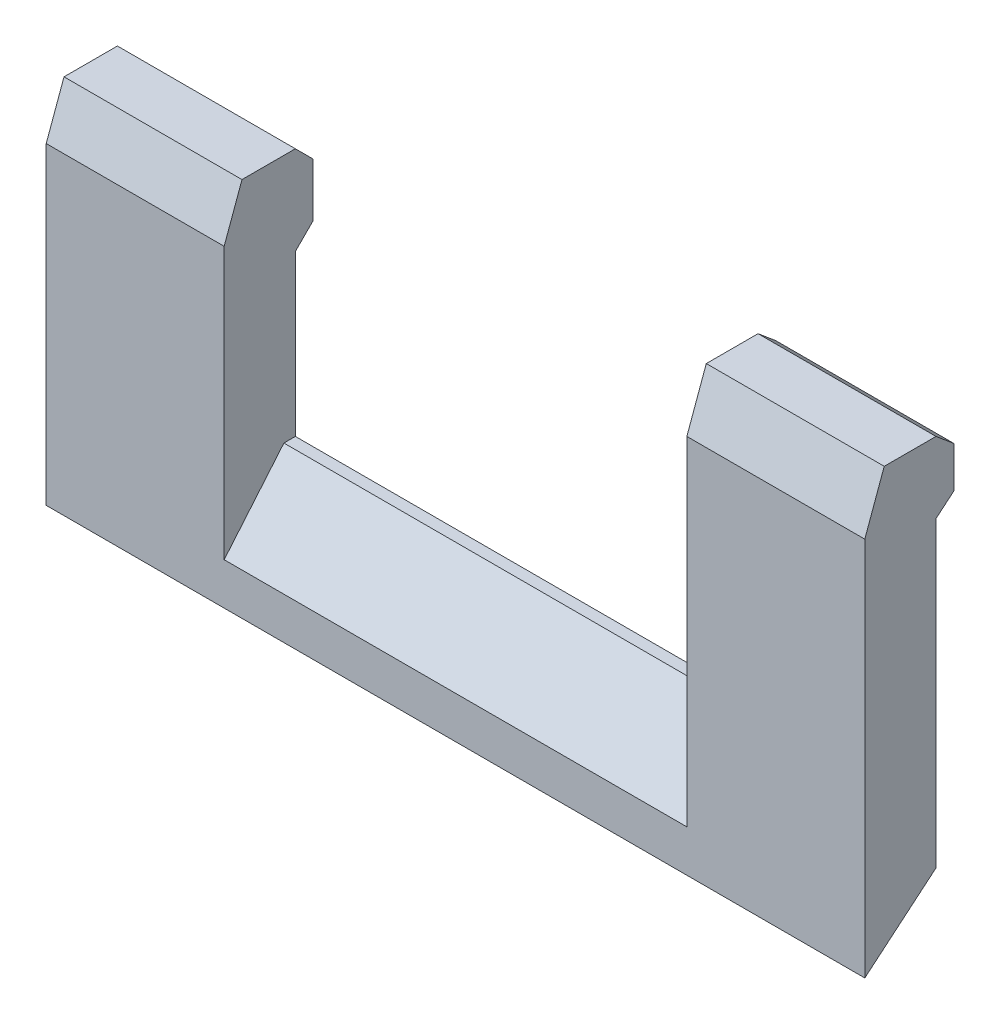
from build123d import *
from OCP.BRepFilletAPI import BRepFilletAPI_MakeChamfer

# Parameters (mm, degrees)
SKETCH_1_W          = 23
SKETCH_1_H          = 2
EXTRUDE_1_DEPTH     = 5
CHAMFER_1_SIZE      = 2
CHAMFER_1_SIZE2     = 1.678199262
SKETCH_2_W          = 5
SKETCH_2_H          = 2
EXTRUDE_2_DEPTH     = 14
CUT_EXTRUDE_1_DEPTH = 27.944387171
SKETCH_4_W          = 5
SKETCH_4_H          = 2
EXTRUDE_3_DEPTH     = 0.5
CHAMFER_3_SIZE      = 0.419549816
CHAMFER_3_SIZE_2    = 0.5
SKETCH_5_W          = 5
SKETCH_5_H          = 2
CUT_EXTRUDE_2_DEPTH = 19.227726134
CHAMFER_4_SIZE      = 1.5
CHAMFER_4_SIZE2     = 0.545955351
SKETCH_6_W          = 5
SKETCH_6_H          = 2
EXTRUDE_4_DEPTH     = 0.5
CHAMFER_5_SIZE      = 0.5
CHAMFER_6_SIZE      = 0.5
CHAMFER_6_SIZE2     = 1.37373871


with BuildPart() as part:
    # 草图1 → 凸台-拉伸1 (new body)
    with BuildSketch(Plane(origin=(0, 0, 0), x_dir=(1, 0, 0), z_dir=(0, 1, 0))):
        Rectangle(SKETCH_1_W, SKETCH_1_H)
    extrude(amount=EXTRUDE_1_DEPTH)

    # 倒角1
    chamfer_1_edges = [part.edges().sort_by_distance(p)[0] for p in [
        (0, 5, 1),
    ]]
    chamfer_1_side = [part.faces().sort_by_distance(p)[0] for p in [
        (0, 2.5, 1),
    ]]
    chamfer(chamfer_1_edges, length=CHAMFER_1_SIZE, length2=CHAMFER_1_SIZE2, reference=chamfer_1_side[0])

    # 草图2 → 凸台-拉伸2 (add)
    with BuildSketch(Plane(origin=(0, 0, 0), x_dir=(1, 0, 0), z_dir=(0, 1, 0))):
        with Locations((-9, 0)):
            Rectangle(SKETCH_2_W, SKETCH_2_H)
        with Locations((9, 0)):
            Rectangle(SKETCH_2_W, SKETCH_2_H)
    extrude(amount=EXTRUDE_2_DEPTH)

    # 草图3 → 切除-拉伸1 (cut, through all)
    with BuildSketch(Plane(origin=(11.5, 0, 0), x_dir=(0, 0, -1), z_dir=(1, 0, 0))):
        Polygon((-1, 1.821800738), (1, 3.5), (1, 0), (-1, 0), align=None)
    extrude(amount=-CUT_EXTRUDE_1_DEPTH, mode=Mode.SUBTRACT)

    # 草图4 → 凸台-拉伸3 (add)
    with BuildSketch(Plane(origin=(0, 0, -1), x_dir=(-1, 0, 0), z_dir=(0, 0, -1))):
        with Locations((-9, 13)):
            Rectangle(SKETCH_4_W, SKETCH_4_H)
    extrude(amount=EXTRUDE_3_DEPTH)

    # 倒角3
    chamfer_3_edges_1 = [part.edges().sort_by_distance(p)[0] for p in [
        (9, 12, -1.5),
    ]]
    chamfer_3_side_1 = [part.faces().sort_by_distance(p)[0] for p in [
        (9, 12.008390996, -1.5),
    ]]
    chamfer_3_edges_2 = [part.edges().sort_by_distance(p)[0] for p in [
        (9, 14, -1.5),
    ]]
    chamfer_3_side_2 = [part.faces().sort_by_distance(p)[0] for p in [
        (9, 13.991609004, -1.5),
    ]]
    chamfer_3 = BRepFilletAPI_MakeChamfer(part.part.solid().wrapped)
    for e in chamfer_3_edges_1:
        chamfer_3.Add(CHAMFER_3_SIZE - 0.0001, CHAMFER_3_SIZE_2 - 0.0001, e.wrapped, chamfer_3_side_1[0].wrapped)
    for e in chamfer_3_edges_2:
        chamfer_3.Add(CHAMFER_3_SIZE - 0.0001, CHAMFER_3_SIZE_2 - 0.0001, e.wrapped, chamfer_3_side_2[0].wrapped)
    add(Compound.cast(chamfer_3.Shape()), mode=Mode.REPLACE)  # a hair under: the kernel refuses the full size

    # 草图5 → 切除-拉伸2 (cut, through all)
    with BuildSketch(Plane(origin=(0, 0, -1), x_dir=(-1, 0, 0), z_dir=(0, 0, -1))):
        with Locations((9, 13)):
            Rectangle(SKETCH_5_W, SKETCH_5_H)
    extrude(amount=-CUT_EXTRUDE_2_DEPTH, mode=Mode.SUBTRACT)

    # 倒角4
    chamfer_4_edges = [part.edges().sort_by_distance(p)[0] for p in [
        (9, 14, 1),
    ]]
    chamfer_4_side = [part.faces().sort_by_distance(p)[0] for p in [
        (0, 2.082052258, 1),
    ]]
    chamfer(chamfer_4_edges, length=CHAMFER_4_SIZE, length2=CHAMFER_4_SIZE2, reference=chamfer_4_side[0])

    # 草图6 → 凸台-拉伸4 (add)
    with BuildSketch(Plane(origin=(0, 0, -1), x_dir=(-1, 0, 0), z_dir=(0, 0, -1))):
        with Locations((9, 11)):
            Rectangle(SKETCH_6_W, SKETCH_6_H)
    extrude(amount=EXTRUDE_4_DEPTH)

    # 倒角5
    chamfer_5_edges = [part.edges().sort_by_distance(p)[0] for p in [
        (-9, 10, -1),
    ]]
    chamfer(chamfer_5_edges, length=CHAMFER_5_SIZE - 0.0001)  # a hair under: the kernel refuses the full size
    chamfer_5_2_edges = [part.edges().sort_by_distance(p)[0] for p in [
        (-9, 12, -1.5),
    ]]
    chamfer(chamfer_5_2_edges, length=CHAMFER_5_SIZE)

    # 倒角6
    chamfer_6_edges = [part.edges().sort_by_distance(p)[0] for p in [
        (-9, 12, 1),
    ]]
    chamfer_6_side = [part.faces().sort_by_distance(p)[0] for p in [
        (-9, 12, 0),
    ]]
    chamfer(chamfer_6_edges, length=CHAMFER_6_SIZE, length2=CHAMFER_6_SIZE2, reference=chamfer_6_side[0])


solid = part.part
